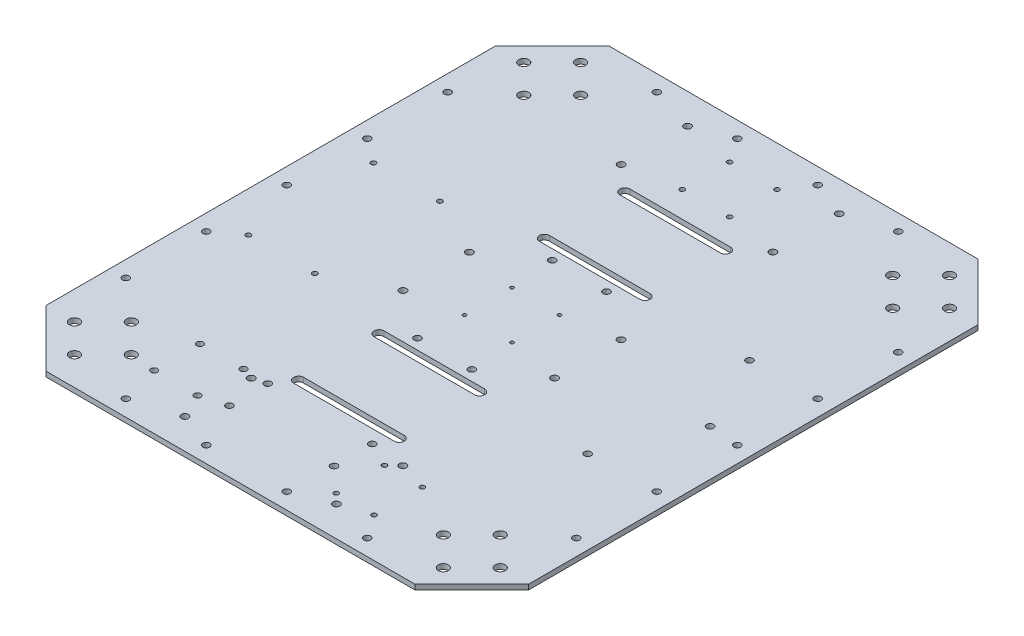
from build123d import *

# Parameters (mm, degrees)
SKETCH1_R               = 2.2225
BOSS_EXTRUDE1_DEPTH     = 3.175
SKETCH2_R               = 2.159
CUT_EXTRUDE1_DEPTH      = 297.247830215
CUT_EXTRUDE2_DEPTH      = 297.247830215
SKETCH7_R               = 1.524
CUT_EXTRUDE3_DEPTH      = 297.247830215
CUT_EXTRUDE4_DEPTH      = 297.247830215
CUT_EXTRUDE4_DEPTH_BACK = 297.247830215
SKETCH8_R               = 1.524
SKETCH9_R               = 2.032
CUT_EXTRUDE5_DEPTH      = 297.247830215
SKETCH10_R              = 2.159
CUT_EXTRUDE6_DEPTH      = 297.247830215
SKETCH12_R              = 1.575
CUT_EXTRUDE7_DEPTH      = 297.247830215
SKETCH13_R              = 1.1
CUT_EXTRUDE8_DEPTH      = 297.247830215
SKETCH14_R              = 3.175
CUT_EXTRUDE9_DEPTH      = 297.247830215
SKETCH15_R              = 2.159
CUT_EXTRUDE10_DEPTH     = 297.247830215
SKETCH16_R              = 2.159
CUT_EXTRUDE11_DEPTH     = 297.247830215


with BuildPart() as part:
    # Sketch1 → Boss-Extrude1 (new body)
    with BuildSketch(Plane(origin=(0, 0, 0), x_dir=(1, 0, 0), z_dir=(0, 1, 0))):
        Polygon((-85.365028143, 123.058976948), (-121.286052627, 87.137952464), (-121.286052627, -196.619998567), (-85.365028143, -232.541023052), (147.592922888, -232.541023052), (183.513947373, -196.619998567), (183.513947373, 87.137952464), (147.592922888, 123.058976948), align=None)
        with Locations((-16.765052627, -213.491023052)):
            Circle(SKETCH1_R, mode=Mode.SUBTRACT)
        with Locations((-16.765052627, -171.581023052)):
            Circle(SKETCH1_R, mode=Mode.SUBTRACT)
        with Locations((-16.765052627, -75.696023052)):
            Circle(SKETCH1_R, mode=Mode.SUBTRACT)
        with Locations((78.992947373, -213.491023052)):
            Circle(SKETCH1_R, mode=Mode.SUBTRACT)
        with Locations((78.992947373, -171.581023052)):
            Circle(SKETCH1_R, mode=Mode.SUBTRACT)
        with Locations((78.992947373, -75.696023052)):
            Circle(SKETCH1_R, mode=Mode.SUBTRACT)
        with Locations((-16.765052627, -33.786023052)):
            Circle(SKETCH1_R, mode=Mode.SUBTRACT)
        with Locations((-16.765052627, 62.098976948)):
            Circle(SKETCH1_R, mode=Mode.SUBTRACT)
        with Locations((-16.765052627, 104.008976948)):
            Circle(SKETCH1_R, mode=Mode.SUBTRACT)
        with Locations((78.992947373, -33.786023052)):
            Circle(SKETCH1_R, mode=Mode.SUBTRACT)
        with Locations((78.992947373, 62.098976948)):
            Circle(SKETCH1_R, mode=Mode.SUBTRACT)
        with Locations((78.992947373, 104.008976948)):
            Circle(SKETCH1_R, mode=Mode.SUBTRACT)
    extrude(amount=BOSS_EXTRUDE1_DEPTH)

    # Sketch2 → Cut-Extrude1 (cut, through all)
    with BuildSketch(Plane(origin=(0, 3.175, 0), x_dir=(1, 0, 0), z_dir=(0, 1, 0))):
        with Locations((13.841947373, -12.069023052)):
            Circle(SKETCH2_R)
        with Locations((48.131947373, -12.069023052)):
            Circle(SKETCH2_R)
        with Locations((13.841947373, -97.159023052)):
            Circle(SKETCH2_R)
        with Locations((48.131947373, -97.159023052)):
            Circle(SKETCH2_R)
    extrude(amount=-CUT_EXTRUDE1_DEPTH, mode=Mode.SUBTRACT)

    # Sketch4 → Cut-Extrude2 (cut, through all)
    with BuildSketch(Plane(origin=(0, 3.175, 0), x_dir=(1, 0, 0), z_dir=(0, 1, 0))):
        with BuildLine():
            Line((-0.636052627, 51.430976948), (62.863947373, 51.430976948))
            ThreePointArc((62.863947373, 51.430976948), (66.038947373, 48.255976948), (62.863947373, 45.080976948))
            Line((62.863947373, 45.080976948), (-0.636052627, 45.080976948))
            ThreePointArc((-0.636052627, 45.080976948), (-3.811052627, 48.255976948), (-0.636052627, 51.430976948))
        make_face()
        with BuildLine():
            Line((-0.636052627, 0.630976948), (62.863947373, 0.630976948))
            ThreePointArc((62.863947373, 0.630976948), (66.038947373, -2.544023052), (62.863947373, -5.719023052))
            Line((62.863947373, -5.719023052), (-0.636052627, -5.719023052))
            ThreePointArc((-0.636052627, -5.719023052), (-3.811052627, -2.544023052), (-0.636052627, 0.630976948))
        make_face()
        with BuildLine():
            Line((-0.636052627, -110.113023052), (62.863947373, -110.113023052))
            ThreePointArc((62.863947373, -110.113023052), (66.038947373, -106.938023052), (62.863947373, -103.763023052))
            Line((62.863947373, -103.763023052), (-0.636052627, -103.763023052))
            ThreePointArc((-0.636052627, -103.763023052), (-3.811052627, -106.938023052), (-0.636052627, -110.113023052))
        make_face()
        with BuildLine():
            Line((-0.636052627, -160.913023052), (62.863947373, -160.913023052))
            ThreePointArc((62.863947373, -160.913023052), (66.038947373, -157.738023052), (62.863947373, -154.563023052))
            Line((62.863947373, -154.563023052), (-0.636052627, -154.563023052))
            ThreePointArc((-0.636052627, -154.563023052), (-3.811052627, -157.738023052), (-0.636052627, -160.913023052))
        make_face()
    extrude(amount=-CUT_EXTRUDE2_DEPTH, mode=Mode.SUBTRACT)

    # Sketch7 → Cut-Extrude3 (cut, through all)
    with BuildSketch(Plane(origin=(0, 3.175, 0), x_dir=(1, 0, 0), z_dir=(0, 1, 0))):
        with Locations((16.127947373, 67.686976948)):
            Circle(SKETCH7_R)
        with Locations((46.099947373, 67.686976948)):
            Circle(SKETCH7_R)
        with Locations((16.127947373, 97.658976948)):
            Circle(SKETCH7_R)
        with Locations((46.099947373, 97.658976948)):
            Circle(SKETCH7_R)
    extrude(amount=-CUT_EXTRUDE3_DEPTH, mode=Mode.SUBTRACT)

    # Sketch8 → Cut-Extrude4 (cut, two sides: drawn at the far end of the back side and taken through both)
    with BuildSketch(Plane(origin=(0, 3.175, 0), x_dir=(1, 0, 0), z_dir=(0, 1, 0)).offset(-CUT_EXTRUDE4_DEPTH_BACK)):
        with Locations((73.023947373, -207.649023052)):
            Circle(SKETCH8_R)
        with Locations((73.023947373, -177.169023052)):
            Circle(SKETCH8_R)
        with Locations((96.899947373, -207.649023052)):
            Circle(SKETCH8_R)
        with Locations((96.899947373, -177.169023052)):
            Circle(SKETCH8_R)
    extrude(amount=CUT_EXTRUDE4_DEPTH + CUT_EXTRUDE4_DEPTH_BACK, mode=Mode.SUBTRACT)

    # Sketch9 → Cut-Extrude5 (cut, through all)
    with BuildSketch(Plane(origin=(0, 0, 0), x_dir=(-1, 0, 0), z_dir=(0, -1, 0))):
        with Locations((51.649412627, -197.969083052)):
            Circle(SKETCH9_R)
        with Locations((24.217412627, -197.969083052)):
            Circle(SKETCH9_R)
        with Locations((51.649412627, -169.013083052)):
            Circle(SKETCH9_R)
        with Locations((24.217412627, -169.013083052)):
            Circle(SKETCH9_R)
    extrude(amount=-CUT_EXTRUDE5_DEPTH, mode=Mode.SUBTRACT)

    # Sketch10 → Cut-Extrude6 (cut, through all)
    with BuildSketch(Plane.XZ):
        with Locations((-8.576092627, 193.475823052)):
            Circle(SKETCH10_R)
        with Locations((57.463907373, 193.475823052)):
            Circle(SKETCH10_R)
        with Locations((-8.576092627, 169.345823052)):
            Circle(SKETCH10_R)
        with Locations((57.463907373, 169.345823052)):
            Circle(SKETCH10_R)
    extrude(amount=-CUT_EXTRUDE6_DEPTH, mode=Mode.SUBTRACT)

    # Sketch12 → Cut-Extrude7 (cut, through all)
    with BuildSketch(Plane.XZ):
        with Locations((-95.886052627, 94.216023052)):
            Circle(SKETCH12_R)
        with Locations((-95.886052627, 15.266023052)):
            Circle(SKETCH12_R)
        with Locations((-53.936052627, 15.266023052)):
            Circle(SKETCH12_R)
        with Locations((-53.936052627, 94.216023052)):
            Circle(SKETCH12_R)
    extrude(amount=-CUT_EXTRUDE7_DEPTH, mode=Mode.SUBTRACT)

    # Sketch13 → Cut-Extrude8 (cut, through all)
    with BuildSketch(Plane.XZ):
        with Locations((16.113947373, 69.741023052)):
            Circle(SKETCH13_R)
        with Locations((16.113947373, 39.741023052)):
            Circle(SKETCH13_R)
        with Locations((46.113947373, 39.741023052)):
            Circle(SKETCH13_R)
        with Locations((46.113947373, 69.741023052)):
            Circle(SKETCH13_R)
    extrude(amount=-CUT_EXTRUDE8_DEPTH, mode=Mode.SUBTRACT)

    # Sketch14 → Cut-Extrude9 (cut, through all)
    with BuildSketch(Plane.XZ):
        with Locations((-103.325540385, 196.619998567)):
            Circle(SKETCH14_R)
        with Locations((-85.365028143, 214.580510809)):
            Circle(SKETCH14_R)
        with Locations((-85.365028143, 178.659486325)):
            Circle(SKETCH14_R)
        with Locations((-67.404515901, 196.619998567)):
            Circle(SKETCH14_R)
        with Locations((129.632410646, 196.619998567)):
            Circle(SKETCH14_R)
        with Locations((147.592922888, 178.659486325)):
            Circle(SKETCH14_R)
        with Locations((165.55343513, 196.619998567)):
            Circle(SKETCH14_R)
        with Locations((147.592922888, 214.580510809)):
            Circle(SKETCH14_R)
        with Locations((-85.365028143, -105.098464706)):
            Circle(SKETCH14_R)
        with Locations((-103.325540385, -87.137952464)):
            Circle(SKETCH14_R)
        with Locations((-85.365028143, -69.177440222)):
            Circle(SKETCH14_R)
        with Locations((-67.404515901, -87.137952464)):
            Circle(SKETCH14_R)
        with Locations((165.55343513, -87.137952464)):
            Circle(SKETCH14_R)
        with Locations((147.592922888, -69.177440222)):
            Circle(SKETCH14_R)
        with Locations((147.592922888, -105.098464706)):
            Circle(SKETCH14_R)
        with Locations((129.632410646, -87.137952464)):
            Circle(SKETCH14_R)
    extrude(amount=-CUT_EXTRUDE9_DEPTH, mode=Mode.SUBTRACT)

    # Sketch15 → Cut-Extrude10 (cut, through all)
    with BuildSketch(Plane.XZ):
        with Locations((5.713947373, 222.381023052)):
            Circle(SKETCH15_R)
        with Locations((-45.086052627, 222.381023052)):
            Circle(SKETCH15_R)
        with Locations((-111.126052627, 54.741023052)):
            Circle(SKETCH15_R)
        with Locations((-111.126052627, 105.541023052)):
            Circle(SKETCH15_R)
        with Locations((-111.126052627, 156.341023052)):
            Circle(SKETCH15_R)
        with Locations((173.353947373, 156.341023052)):
            Circle(SKETCH15_R)
        with Locations((173.353947373, 105.541023052)):
            Circle(SKETCH15_R)
        with Locations((173.353947373, 54.741023052)):
            Circle(SKETCH15_R)
        with Locations((107.313947373, 222.381023052)):
            Circle(SKETCH15_R)
        with Locations((56.513947373, 222.381023052)):
            Circle(SKETCH15_R)
        with Locations((56.513947373, -112.898976948)):
            Circle(SKETCH15_R)
        with Locations((107.313947373, -112.898976948)):
            Circle(SKETCH15_R)
        with Locations((173.353947373, 3.941023052)):
            Circle(SKETCH15_R)
        with Locations((173.353947373, -46.858976948)):
            Circle(SKETCH15_R)
        with Locations((-111.126052627, -46.858976948)):
            Circle(SKETCH15_R)
        with Locations((-111.126052627, 3.941023052)):
            Circle(SKETCH15_R)
        with Locations((-45.086052627, -112.898976948)):
            Circle(SKETCH15_R)
        with Locations((5.713947373, -112.898976948)):
            Circle(SKETCH15_R)
    extrude(amount=-CUT_EXTRUDE10_DEPTH, mode=Mode.SUBTRACT)

    # Sketch16 → Cut-Extrude11 (cut, through all)
    with BuildSketch(Plane(origin=(0, 0, 0), x_dir=(-1, 0, 0), z_dir=(0, -1, 0))):
        with Locations((-130.865574362, -106.679409794)):
            Circle(SKETCH16_R)
        with Locations((-130.865574362, -4.529409794)):
            Circle(SKETCH16_R)
        with Locations((-154.465574362, -53.029409794)):
            Circle(SKETCH16_R)
    extrude(amount=-CUT_EXTRUDE11_DEPTH, mode=Mode.SUBTRACT)


solid = part.part
